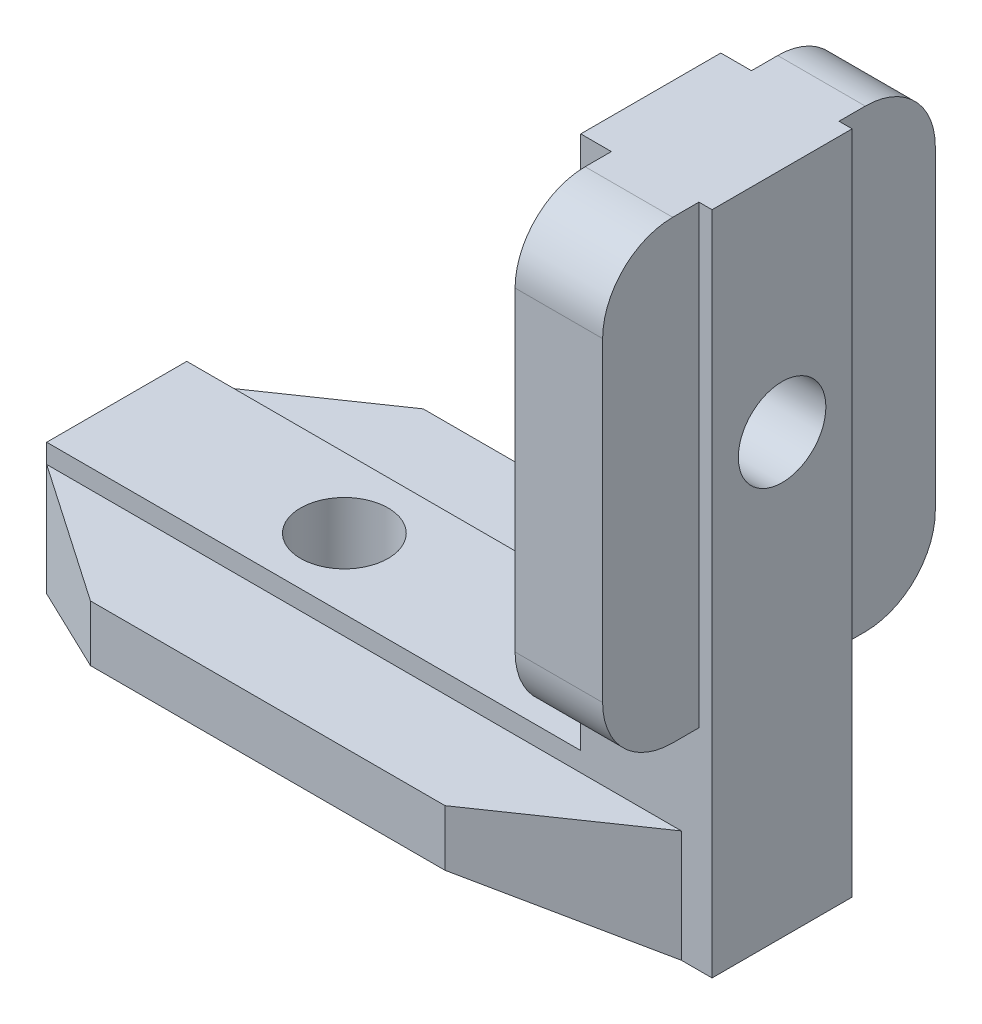
from build123d import *

# Parameters (mm, degrees)
EXTRUDE_1_DEPTH        = 4
EXTRUDE_1_DEPTH_BACK   = 4
EXTRUDE_2_DEPTH        = 36.25
CHAMFER_1_SIZE         = 8
CHAMFER_1_SIZE_2       = 5.5
EXTRUDE_3_DEPTH        = 2.5
EXTRUDE_3_DEPTH_BACK   = 2.5
HOLE_WIZARD_M6_1_D     = 5
HOLE_WIZARD_M6_1_DEPTH = 17
HOLE_WIZARD_M6_1_TIP   = 1.502151548
HOLE_WIZARD_M6_2_D     = 5
HOLE_WIZARD_M6_2_DEPTH = 17
HOLE_WIZARD_M6_2_TIP   = 1.502151548


with BuildPart() as part:
    # 草图1 → 凸台-拉伸1 (new, two sides: drawn at the far end of the back side and taken through both)
    with BuildSketch(Plane.XY.offset(-EXTRUDE_1_DEPTH_BACK)):
        Polygon((0, 7.5), (30.5, 7.5), (30.5, 38), (38, 38), (38, 0), (0, 0), align=None)
    extrude(amount=EXTRUDE_1_DEPTH + EXTRUDE_1_DEPTH_BACK)

    # 草图2 → 凸台-拉伸2 (add)
    with BuildSketch(Plane.ZY):
        Polygon((4, 6.4), (9.5, 6.4), (9.5, 3.2), (4, 0), align=None)
        Polygon((-4, 0), (-4, 6.4), (-9.5, 6.4), (-9.5, 3.2), align=None)
    extrude(amount=-EXTRUDE_2_DEPTH)

    # 倒角1
    # the kernel refuses this chamfer: 8, 5.5 mm, written as the material it takes off along each edge
    with BuildSketch(Plane(origin=(36.25, 27.064204354, -9.5), x_dir=(0.021932761143399794, 0, 0.9997594480616957), z_dir=(0, -1, 0))) as chamfer_1_piece_1_section:
        Polygon((CHAMFER_1_SIZE * 0.999759448062, CHAMFER_1_SIZE * 0.0219327611434), (-CHAMFER_1_SIZE_2 * 0.0219327611434, CHAMFER_1_SIZE_2 * 0.999759448062), (0, 0), align=None)
    chamfer_1_piece_1 = extrude(amount=44.528408708, mode=Mode.PRIVATE)
    chamfer_1_piece_1 = split(chamfer_1_piece_1, bisect_by=Plane(origin=(34.285815681, 4.8, -4), z_dir=(0, 0, -1)), keep=Keep.TOP, mode=Mode.PRIVATE)
    add(chamfer_1_piece_1, mode=Mode.SUBTRACT)
    with BuildSketch(Plane(origin=(36.25, 27.064204354, 9.5), x_dir=(0.046364447759701236, 0, -0.9989245907394302), z_dir=(0, -1, 0))) as chamfer_1_piece_2_section:
        Polygon((CHAMFER_1_SIZE_2 * 0.998924590739, -CHAMFER_1_SIZE_2 * 0.0463644477597), (-CHAMFER_1_SIZE * 0.0463644477597, -CHAMFER_1_SIZE * 0.998924590739), (0, 0), align=None)
    chamfer_1_piece_2 = extrude(amount=44.528408708, mode=Mode.PRIVATE)
    chamfer_1_piece_2 = split(chamfer_1_piece_2, bisect_by=Plane(origin=(33.577095366, 4.8, 4), z_dir=(0, 0, 1)), keep=Keep.TOP, mode=Mode.PRIVATE)
    add(chamfer_1_piece_2, mode=Mode.SUBTRACT)
    with BuildSketch(Plane(origin=(0, 27.064204354, 9.5), x_dir=(-0.046364447759701714, 0, -0.9989245907394302), z_dir=(0, -1, 0))) as chamfer_1_piece_3:
        Polygon((CHAMFER_1_SIZE_2 * 0.998924590739, CHAMFER_1_SIZE_2 * 0.0463644477597), (-CHAMFER_1_SIZE * 0.0463644477597, CHAMFER_1_SIZE * 0.998924590739), (0, 0), align=None)
    extrude(amount=44.528408708, mode=Mode.SUBTRACT)
    with BuildSketch(Plane(origin=(0, 27.064204354, -9.5), x_dir=(-0.046364447759701714, 0, 0.9989245907394302), z_dir=(0, -1, 0))) as chamfer_1_piece_4:
        Polygon((CHAMFER_1_SIZE_2 * 0.998924590739, -CHAMFER_1_SIZE_2 * 0.0463644477597), (-CHAMFER_1_SIZE * 0.0463644477597, -CHAMFER_1_SIZE * 0.998924590739), (0, 0), align=None)
    extrude(amount=44.528408708, mode=Mode.SUBTRACT)

    # 草图3 → 凸台-拉伸3 (add, two sides: drawn at the far end of the back side and taken through both)
    with BuildSketch(Plane.ZY.offset(-34.75).offset(-EXTRUDE_3_DEPTH_BACK)):
        with BuildLine():
            Line((4, 38), (5.5, 38))
            ThreePointArc((5.5, 38), (8.328427125, 36.828427125), (9.5, 34))
            Line((9.5, 34), (9.5, 16))
            ThreePointArc((9.5, 16), (8.328427125, 13.171572875), (5.5, 12))
            Line((5.5, 12), (4, 12))
            Line((4, 12), (4, 38))
        make_face()
        with BuildLine():
            Line((-9.5, 34), (-9.5, 16))
            ThreePointArc((-9.5, 16), (-8.328427125, 13.171572875), (-5.5, 12))
            Line((-5.5, 12), (-4, 12))
            Line((-4, 12), (-4, 38))
            Line((-4, 38), (-5.5, 38))
            ThreePointArc((-5.5, 38), (-8.328427125, 36.828427125), (-9.5, 34))
        make_face()
    extrude(amount=EXTRUDE_3_DEPTH + EXTRUDE_3_DEPTH_BACK)

    # M6 螺纹孔1
    with Locations(Plane(origin=(30.5, 25, 0), x_dir=(0, 0, -1), z_dir=(-1, 0, 0))):
        with Locations((0, 0)):
            Hole(HOLE_WIZARD_M6_1_D / 2, depth=HOLE_WIZARD_M6_1_DEPTH)
            with Locations((0, 0, -(HOLE_WIZARD_M6_1_DEPTH + HOLE_WIZARD_M6_1_TIP / 2))):  # 118° drill point
                Cone(0, HOLE_WIZARD_M6_1_D / 2, HOLE_WIZARD_M6_1_TIP, mode=Mode.SUBTRACT)

    # M6 螺纹孔2
    with Locations(Plane(origin=(13, 7.5, 0), x_dir=(0, 0, 1), z_dir=(0, 1, 0))):
        with Locations((0, 0)):
            Hole(HOLE_WIZARD_M6_2_D / 2, depth=HOLE_WIZARD_M6_2_DEPTH)
            with Locations((0, 0, -(HOLE_WIZARD_M6_2_DEPTH + HOLE_WIZARD_M6_2_TIP / 2))):  # 118° drill point
                Cone(0, HOLE_WIZARD_M6_2_D / 2, HOLE_WIZARD_M6_2_TIP, mode=Mode.SUBTRACT)


solid = part.part
